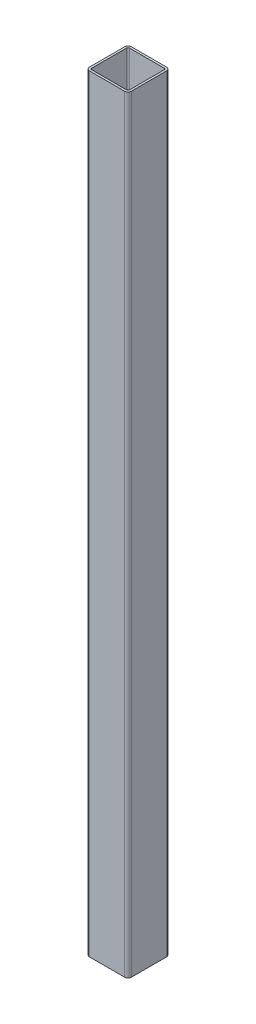
from build123d import *

# Parameters (mm, degrees)
EXTRUDE_1_DEPTH = 1100


with BuildPart() as part:
    # Эскиз1 → Вытянуть-Тонкостенный1 (new body)
    with BuildSketch(Plane(origin=(0, 0, 0), x_dir=(1, 0, 0), z_dir=(0, 1, 0))):
        with BuildLine():
            Line((-25, 30), (25, 30))
            ThreePointArc((25, 30), (28.535533906, 28.535533906), (30, 25))
            Line((30, 25), (30, -25))
            ThreePointArc((30, -25), (28.535533906, -28.535533906), (25, -30))
            Line((25, -30), (-25, -30))
            ThreePointArc((-25, -30), (-28.535533906, -28.535533906), (-30, -25))
            Line((-30, -25), (-30, 25))
            ThreePointArc((-30, 25), (-28.535533906, 28.535533906), (-25, 30))
        make_face()
        with BuildLine():
            Line((-25, 27), (25, 27))
            ThreePointArc((25, 27), (26.414213562, 26.414213562), (27, 25))
            Line((27, 25), (27, -25))
            ThreePointArc((27, -25), (26.414213562, -26.414213562), (25, -27))
            Line((25, -27), (-25, -27))
            ThreePointArc((-25, -27), (-26.414213562, -26.414213562), (-27, -25))
            Line((-27, -25), (-27, 25))
            ThreePointArc((-27, 25), (-26.414213562, 26.414213562), (-25, 27))
        make_face(mode=Mode.SUBTRACT)
    extrude(amount=EXTRUDE_1_DEPTH)


solid = part.part
